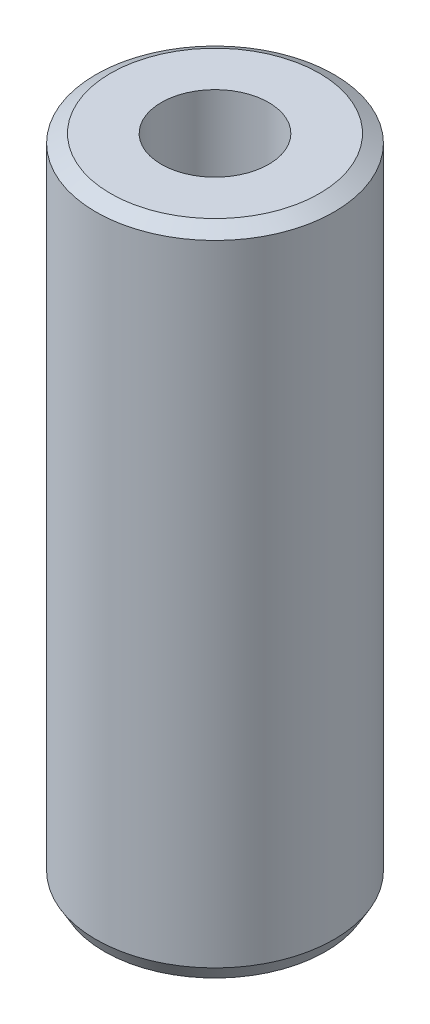
from build123d import *
from OCP.BRepFilletAPI import BRepFilletAPI_MakeChamfer

# Parameters (mm, degrees)
SKETCH1_R           = 47.5
BOSS_EXTRUDE1_DEPTH = 260.542871571
SKETCH2_R           = 21.401230563
CUT_EXTRUDE1_DEPTH  = 270.063352998
CHAMFER1_SIZE       = 3.400357938
CHAMFER1_SIZE2      = 5.889592712


with BuildPart() as part:
    # Sketch1 → Boss-Extrude1 (new body)
    with BuildSketch(Plane(origin=(0, 0, 0), x_dir=(1, 0, 0), z_dir=(0, 1, 0))):
        Circle(SKETCH1_R)
    extrude(amount=BOSS_EXTRUDE1_DEPTH)

    # Sketch2 → Cut-Extrude1 (cut, through all)
    with BuildSketch(Plane(origin=(0, 0, 0), x_dir=(1, 0, 0), z_dir=(0, 1, 0))):
        Circle(SKETCH2_R)
    extrude(amount=CUT_EXTRUDE1_DEPTH, mode=Mode.SUBTRACT)

    # Chamfer1: one chamfer whose edges measure the first distance from different faces: ONE call of the kernel's chamfer builder (chamfer() names one face for all edges)
    chamfer1_edges_1 = [part.edges().sort_by_distance(p)[0] for p in [
        (-47.5, 260.542871571, 0),
    ]]
    chamfer1_side_1 = [part.faces().sort_by_distance(p)[0] for p in [
        (-47.5, 130.271435786, 0),
    ]]
    chamfer1_edges_2 = [part.edges().sort_by_distance(p)[0] for p in [
        (-47.5, 0, 0),
    ]]
    chamfer1_side_2 = [part.faces().sort_by_distance(p)[0] for p in [
        (-46.156497116, 0, 0),
    ]]
    chamfer1 = BRepFilletAPI_MakeChamfer(part.part.solid().wrapped)
    for e in chamfer1_edges_1:
        chamfer1.Add(CHAMFER1_SIZE, CHAMFER1_SIZE2, e.wrapped, chamfer1_side_1[0].wrapped)  # the first distance lies on this face
    for e in chamfer1_edges_2:
        chamfer1.Add(CHAMFER1_SIZE, CHAMFER1_SIZE2, e.wrapped, chamfer1_side_2[0].wrapped)  # the first distance lies on this face
    add(Compound.cast(chamfer1.Shape()), mode=Mode.REPLACE)


solid = part.part
